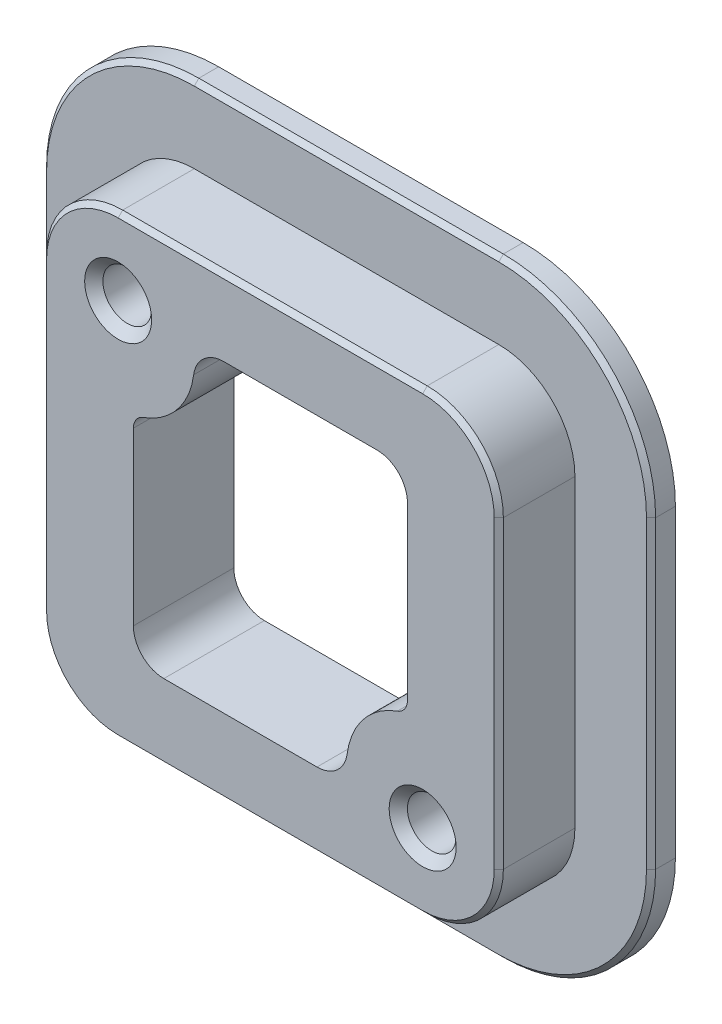
from build123d import *

# Parameters (mm, degrees)
SKIZZE1_W          = 30
SKIZZE1_H          = 30
GRUNDK_RPER_DEPTH  = 5
VERRUNDUNG1_R      = 5
ABSATZ_DEPTH       = 1.6
SKIZZE3_R          = 1.6
M3_BOHRUNGEN_DEPTH = 30.044104393
M3_SCHSKANT_DEPTH  = 3
DURCHBRUCH_DEPTH   = 30.044104393
VERRUNDUNG2_R      = 5
VERRUNDUNG3_R      = 2
VERRUNDUNG4_R      = 1
FASE1_SIZE         = 0.3
FASE2_SIZE         = 0.6


with BuildPart() as part:
    # Skizze1 → Grundkörper (new body)
    with BuildSketch(Plane.XY):
        Rectangle(SKIZZE1_W, SKIZZE1_H)
    extrude(amount=GRUNDK_RPER_DEPTH)

    # Verrundung1
    verrundung1_edges = [part.edges().sort_by_distance(p)[0] for p in [
        (-15, 15, 2.5),
        (15, 15, 2.5),
        (15, -15, 2.5),
        (-15, -15, 2.5),
    ]]
    fillet(verrundung1_edges, radius=VERRUNDUNG1_R)

    # Skizze2 → Absatz (add)
    with BuildSketch(Plane(origin=(0, 0, 0), x_dir=(-1, 0, 0), z_dir=(0, 0, -1))):
        with BuildLine():
            Line((20, -10), (20, 10))
            ThreePointArc((20, 10), (17.071067812, 17.071067812), (10, 20))
            Line((10, 20), (-10, 20))
            ThreePointArc((-10, 20), (-17.071067812, 17.071067812), (-20, 10))
            Line((-20, 10), (-20, -10))
            ThreePointArc((-20, -10), (-17.071067812, -17.071067812), (-10, -20))
            Line((-10, -20), (10, -20))
            ThreePointArc((10, -20), (17.071067812, -17.071067812), (20, -10))
        make_face()
    extrude(amount=ABSATZ_DEPTH)

    # Skizze3 → M3 Bohrungen (cut, through all)
    with BuildSketch(Plane.XY.offset(5)):
        with Locations((-10, 10)):
            Circle(SKIZZE3_R)
        with Locations((10, -10)):
            Circle(SKIZZE3_R)
    extrude(amount=-M3_BOHRUNGEN_DEPTH, mode=Mode.SUBTRACT)

    # Skizze4 → M3 Schskant (cut)
    with BuildSketch(Plane(origin=(0, 0, -1.6), x_dir=(-1, 0, 0), z_dir=(0, 0, -1))):
        Polygon((10, 6.535898385), (13, 8.267949192), (13, 11.732050808), (10, 13.464101615), (7, 11.732050808), (7, 8.267949192), align=None)
        Polygon((-10, -6.535898385), (-13, -8.267949192), (-13, -11.732050808), (-10, -13.464101615), (-7, -11.732050808), (-7, -8.267949192), align=None)
    extrude(amount=-M3_SCHSKANT_DEPTH, mode=Mode.SUBTRACT)

    # Skizze5 → Durchbruch (cut, through all)
    with BuildSketch(Plane.XY.offset(5)):
        Polygon((5, 10), (-5, 10), (-5, 4), (-9, 4), (-9, -10), (-5, -10), (5, -10), (5, -4), (9, -4), (9, 10), align=None)
    extrude(amount=-DURCHBRUCH_DEPTH, mode=Mode.SUBTRACT)

    # Verrundung2
    # the kernel refuses this fillet: 5 mm, written as the material it takes off along each edge
    with BuildSketch(Plane(origin=(5, -4, 17.247448714), x_dir=(1.0, -1.5394352459447556e-12, 0), z_dir=(0, 0, -1)), Plane(origin=(-5, 4, 17.247448714), x_dir=(-1.0, 1.5605294834126232e-12, 0), z_dir=(0, 0, -1))) as verrundung2_piece_1:
        with BuildLine():
            CenterArc((5, 4.898979486), VERRUNDUNG2_R, 180, 78.463040967)
            Line((0, 4.898979486), (-0.1, 4.898979486))
            Line((-0.1, 4.898979486), (-0.1, 0))
            Line((-0.1, 0), (0, -0.1))
            ThreePointArc((0, -0.1), (2, -0.1), (3.98, -0.09797959))
            Line((3.98, -0.09797959), (4, 0))
        make_face()
    extrude(amount=31.094897428, mode=Mode.SUBTRACT)

    # Verrundung3
    verrundung3_edges = [part.edges().sort_by_distance(p)[0] for p in [
        (5, -10, 1.7),
        (-9, -10, 1.7),
        (-5, 10, 1.7),
        (9, 10, 1.7),
    ]]
    fillet(verrundung3_edges, radius=VERRUNDUNG3_R)

    # Verrundung4
    verrundung4_edges = [part.edges().sort_by_distance(p)[0] for p in [
        (-9, 4, 1.7),
        (9, -4, 1.7),
    ]]
    fillet(verrundung4_edges, radius=VERRUNDUNG4_R)

    # Fase1
    fase1_edges = [part.edges().sort_by_distance(p)[0] for p in [
        (-15, 0, 5),
        (0, 15, 5),
        (0, -15, 5),
        (15, 0, 5),
        (13.535533906, 13.535533906, 5),
        (13.535533906, -13.535533906, 5),
        (-13.535533906, -13.535533906, 5),
        (-13.535533906, 13.535533906, 5),
        (-17.071067812, -17.071067812, 0),
        (-20, 0, 0),
        (-17.071067812, 17.071067812, 0),
        (0, 20, 0),
        (17.071067812, 17.071067812, 0),
        (20, 0, 0),
        (17.071067812, -17.071067812, 0),
        (0, -20, 0),
    ]]
    chamfer(fase1_edges, length=FASE1_SIZE)

    # Fase2
    fase2_edges = [part.edges().sort_by_distance(p)[0] for p in [
        (-11.6, 10, 5),
        (8.4, -10, 5),
    ]]
    chamfer(fase2_edges, length=FASE2_SIZE)


solid = part.part
